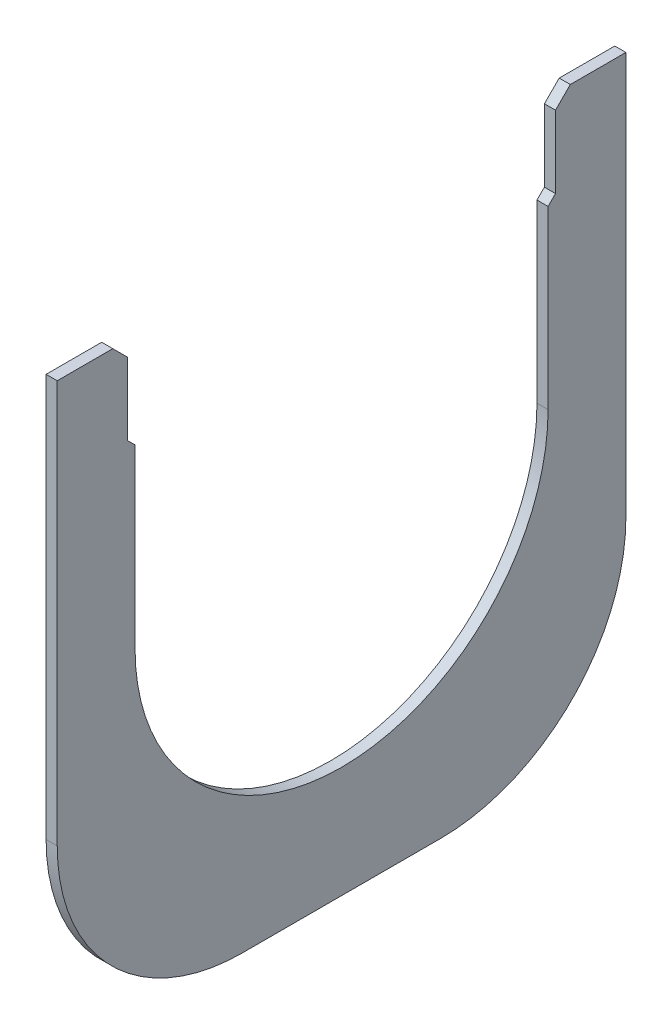
from build123d import *

# Parameters (mm, degrees)
SM_START                 = -3
SM_BASE_FLANGE_1_DEPTH   = 6
CUT_EXTRUDE_1_DEPTH      = 231.181450165
CUT_EXTRUDE_1_DEPTH_BACK = 231.181450165
SKETCH_7_W               = 4
SKETCH_7_H               = 47
CHAMFER_2_SIZE           = 8
CHAMFER_3_SIZE           = 4


# Read off the part's stored shape, not the designer's step: Базовая кромка1
with BuildPart() as part:
    # Базовая кромка1 outline → Базовая кромка1 (new body)
    with BuildSketch(Plane(origin=(0, 0, 0), x_dir=(0, 0, -1), z_dir=(1, 0, 0)).offset(SM_START)):
        with BuildLine():
            Line((-111.5, 0), (-111.5, 146))
            Line((-111.5, 146), (-153.5, 146))
            Line((-153.5, 146), (-153.5, -71.5))
            ThreePointArc((-153.5, -71.5), (-124.210678119, -142.210678119), (-53.5, -171.5))
            Line((-53.5, -171.5), (53.5, -171.5))
            ThreePointArc((53.5, -171.5), (124.210678119, -142.210678119), (153.5, -71.5))
            Line((153.5, -71.5), (153.5, 146))
            Line((153.5, 146), (111.5, 146))
            Line((111.5, 146), (111.5, 0))
            ThreePointArc((111.5, 0), (0, -111.5), (-111.5, 0))
        make_face()
    extrude(amount=SM_BASE_FLANGE_1_DEPTH)

    # Эскиз7 → Вырез-Вытянуть1 (cut, two sides: drawn at the far end of the back side and taken through both)
    with BuildSketch(Plane(origin=(0, 0, 0), x_dir=(0, 0, -1), z_dir=(1, 0, 0)).offset(-CUT_EXTRUDE_1_DEPTH_BACK)):
        with Locations((-113.5, 122.5)):
            Rectangle(SKETCH_7_W, SKETCH_7_H)
        with Locations((113.5, 122.5)):
            Rectangle(SKETCH_7_W, SKETCH_7_H)
    extrude(amount=CUT_EXTRUDE_1_DEPTH + CUT_EXTRUDE_1_DEPTH_BACK, mode=Mode.SUBTRACT)

    # Фаска2
    chamfer_2_edges = [part.edges().sort_by_distance(p)[0] for p in [
        (0, 146, 115.5),
        (0, 146, -115.5),
    ]]
    chamfer(chamfer_2_edges, length=CHAMFER_2_SIZE)

    # Фаска3
    chamfer_3_edges = [part.edges().sort_by_distance(p)[0] for p in [
        (0, 99, -111.5),
        (0, 99, 111.5),
    ]]
    chamfer(chamfer_3_edges, length=CHAMFER_3_SIZE - 0.0001)  # a hair under: the kernel refuses the full size


solid = part.part
